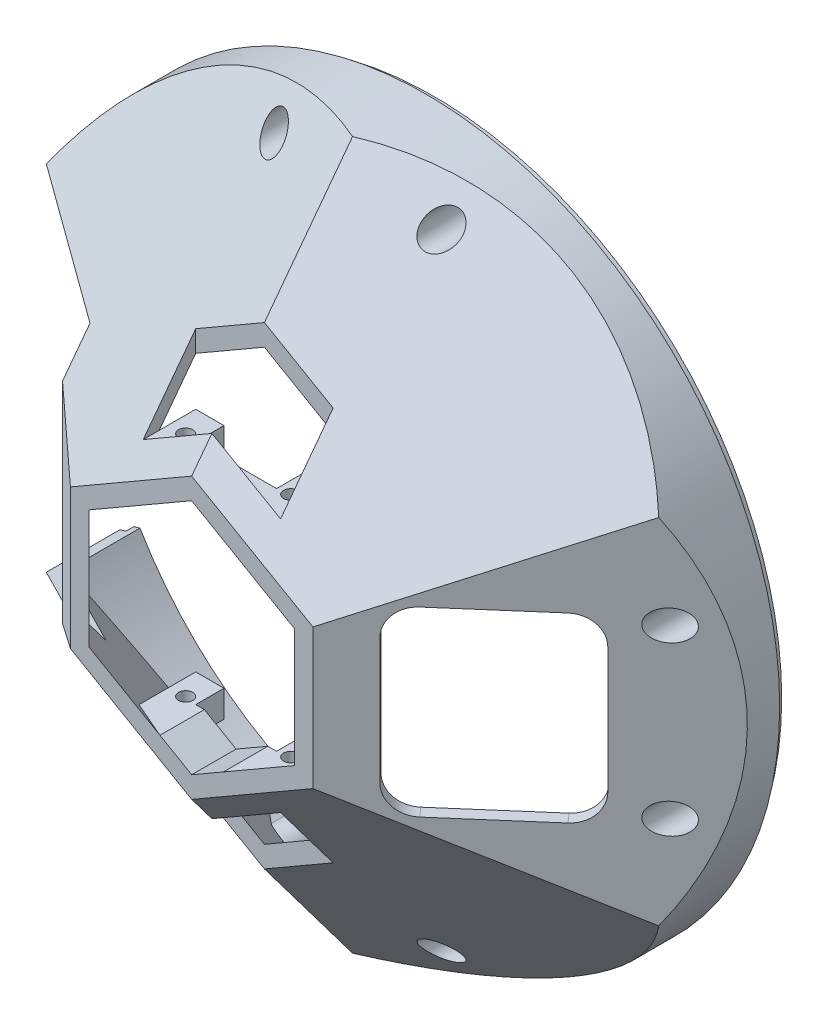
from build123d import *

# Parameters (mm, degrees)
SKETCH1_R                    = 87.5
BOSS_EXTRUDE1_DEPTH          = 60
CUT_EXTRUDE1_DEPTH           = 138.522725395
CIRPATTERN1_COUNT            = 6
SHELL1_T                     = -3
SKETCH3_R                    = 87.5
SKETCH3_R_2                  = 86
CUT_EXTRUDE2_DEPTH           = 2
CUT_EXTRUDE3_DEPTH           = 138.522725395
BOSS_EXTRUDE2_REACH          = 139.523
SKETCH6_R                    = 1.75
CUT_EXTRUDE4_DEPTH           = 138.522725395
SKETCH7_R                    = 3.75
CUT_EXTRUDE5_DEPTH           = 55
CIRPATTERN2_COPY_1_REACH     = 139.523
CIRPATTERN2_COPY_2_REACH     = 139.523
CIRPATTERN2_COPY_3_SKETCH_R  = 1.75
CIRPATTERN2_COPY_3_DEPTH     = 138.522725395
CIRPATTERN2_COPY_4_SKETCH_R  = 1.75
CIRPATTERN2_COPY_4_DEPTH     = 138.522725395
CIRPATTERN2_COPY_5_SKETCH_R  = 3.75
CIRPATTERN2_COPY_5_DEPTH     = 55
CIRPATTERN2_COPY_6_SKETCH_R  = 3.75
CIRPATTERN2_COPY_6_DEPTH     = 55
CIRPATTERN2_COPY_7_REACH     = 139.523
CIRPATTERN2_COPY_8_REACH     = 139.523
CIRPATTERN2_COPY_9_SKETCH_R  = 1.75
CIRPATTERN2_COPY_9_DEPTH     = 138.522725395
CIRPATTERN2_COPY_10_SKETCH_R = 1.75
CIRPATTERN2_COPY_10_DEPTH    = 138.522725395
CIRPATTERN2_COPY_11_SKETCH_R = 3.75
CIRPATTERN2_COPY_11_DEPTH    = 55
CIRPATTERN2_COPY_12_SKETCH_R = 3.75
CIRPATTERN2_COPY_12_DEPTH    = 55
CUT_EXTRUDE6_DEPTH           = 156.173102014
SKETCH10_W                   = 34
SKETCH10_H                   = 13
CUT_EXTRUDE8_DEPTH           = 138.522725395
BOSS_EXTRUDE4_REACH          = 132.677
SKETCH13_R                   = 1.75
SKETCH13_W                   = 20
SKETCH13_H                   = 7
CUT_EXTRUDE9_DEPTH           = 8


with BuildPart() as part:
    # Sketch1 → Boss-Extrude1 (new body)
    with BuildSketch(Plane.XY):
        Circle(SKETCH1_R)
    extrude(amount=BOSS_EXTRUDE1_DEPTH)

    # Sketch2 → Cut-Extrude1 (cut, symmetric)
    with BuildSketch(Plane(origin=(0, 0, 0), x_dir=(1, 0, 0), z_dir=(0, 1, 0))):
        Polygon((-73.465543034, -109.985374489), (-130.965543034, -59.985374489), (-87.5, -10), (-30, -60), align=None)
    cut_extrude1 = extrude(amount=CUT_EXTRUDE1_DEPTH, both=True, mode=Mode.SUBTRACT)

    # CirPattern1: Cut-Extrude1 ×6 about axis
    cirpattern1_axis = Axis((0, 0, 0), (0, 0, 1))
    for i in range(1, CIRPATTERN1_COUNT):
        add(cut_extrude1.rotate(cirpattern1_axis, i * 360 / CIRPATTERN1_COUNT), mode=Mode.SUBTRACT)

    # Shell1
    shell1_openings = [part.faces().sort_by_distance(p)[0] for p in [
        (0, 0, 0),
        (0, 0, 60),
    ]]
    offset(amount=SHELL1_T, openings=shell1_openings)

    # Sketch3 → Cut-Extrude2 (cut)
    with BuildSketch(Plane(origin=(0, 0, 0), x_dir=(-1, 0, 0), z_dir=(0, 0, -1))):
        Circle(SKETCH3_R)
        Circle(SKETCH3_R_2, mode=Mode.SUBTRACT)
    extrude(amount=-CUT_EXTRUDE2_DEPTH, mode=Mode.SUBTRACT)

    # Sketch4 → Cut-Extrude3 (cut, through all)
    with BuildSketch(Plane.XY):
        with BuildLine():
            Line((-45, 35), (-45, -35))
            Line((-45, -35), (-75.777222831, -43.75))
            ThreePointArc((-75.777222831, -43.75), (-87.5, 0), (-75.777222831, 43.75))
            Line((-75.777222831, 43.75), (-45, 35))
        make_face()
    extrude(amount=CUT_EXTRUDE3_DEPTH, mode=Mode.SUBTRACT)

    # Sketch5 → Boss-Extrude2 (add, up to next)
    with BuildSketch(Plane.XY, mode=Mode.PRIVATE) as boss_extrude2_sk1:
        with BuildLine():
            Line((-23.508288122, 73.13347302), (-31.375780211, 78.458972821))
            ThreePointArc((-31.375780211, 78.458972821), (-21.870209311, 81.620732321), (-12.057263685, 83.635353723))
            Line((-12.057263685, 83.635353723), (-16.207961797, 75.089589564))
            ThreePointArc((-16.207961797, 75.089589564), (-19.411428383, 72.444436972), (-23.508288122, 73.13347302))
        make_face()
    boss_extrude2_tool1 = extrude(boss_extrude2_sk1.sketch, amount=BOSS_EXTRUDE2_REACH, mode=Mode.PRIVATE) - part.part
    boss_extrude2 = boss_extrude2_tool1.solids().sort_by_distance((-20.887689, 77.953916, 0))[0]
    add(boss_extrude2)

    # Sketch6 → Cut-Extrude4 (cut, through all)
    with BuildSketch(Plane(origin=(0, 0, 0), x_dir=(-1, 0, 0), z_dir=(0, 0, -1))):
        with Locations((20.705523608, 77.274066103)):
            Circle(SKETCH6_R)
    cut_extrude4 = extrude(amount=-CUT_EXTRUDE4_DEPTH, mode=Mode.SUBTRACT)

    # Sketch7 → Cut-Extrude5 (cut)
    with BuildSketch(Plane.XY.offset(60)):
        with Locations((-20.705523608, 77.274066103)):
            Circle(SKETCH7_R)
    cut_extrude5 = extrude(amount=-CUT_EXTRUDE5_DEPTH, mode=Mode.SUBTRACT)

    # Mirror1: Boss-Extrude2, Cut-Extrude4, Cut-Extrude5 across plane
    add(boss_extrude2.mirror(Plane(origin=(0, 0, 0), x_dir=(0, 0, 1), z_dir=(1, 0, 0))))
    add(cut_extrude4.mirror(Plane(origin=(0, 0, 0), x_dir=(0, 0, 1), z_dir=(1, 0, 0))), mode=Mode.SUBTRACT)
    add(cut_extrude5.mirror(Plane(origin=(0, 0, 0), x_dir=(0, 0, 1), z_dir=(1, 0, 0))), mode=Mode.SUBTRACT)

    # CirPattern2 copy 1 sketch → CirPattern2 copy 1 (add, up to next)
    with BuildSketch(Plane(origin=(0, 0, 0), x_dir=(0, 1, 0), z_dir=(0, 0, 1)), mode=Mode.PRIVATE) as cirpattern2_copy_1_sk1:
        with BuildLine():
            Line((-23.508288122, -73.13347302), (-31.375780211, -78.458972821))
            ThreePointArc((-31.375780211, -78.458972821), (-21.870209311, -81.620732321), (-12.057263685, -83.635353723))
            Line((-12.057263685, -83.635353723), (-16.207961797, -75.089589564))
            ThreePointArc((-16.207961797, -75.089589564), (-19.411428383, -72.444436972), (-23.508288122, -73.13347302))
        make_face()
    cirpattern2_copy_1_tool1 = extrude(cirpattern2_copy_1_sk1.sketch, amount=CIRPATTERN2_COPY_1_REACH, mode=Mode.PRIVATE) - part.part
    add(cirpattern2_copy_1_tool1.solids().sort_by_distance((77.953916, -20.887689, 0))[0])

    # CirPattern2 copy 2 sketch → CirPattern2 copy 2 (add, up to next)
    with BuildSketch(Plane.XY, mode=Mode.PRIVATE) as cirpattern2_copy_2_sk1:
        with BuildLine():
            Line((-23.508288122, -73.13347302), (-31.375780211, -78.458972821))
            ThreePointArc((-31.375780211, -78.458972821), (-21.870209311, -81.620732321), (-12.057263685, -83.635353723))
            Line((-12.057263685, -83.635353723), (-16.207961797, -75.089589564))
            ThreePointArc((-16.207961797, -75.089589564), (-19.411428383, -72.444436972), (-23.508288122, -73.13347302))
        make_face()
    cirpattern2_copy_2_tool1 = extrude(cirpattern2_copy_2_sk1.sketch, amount=CIRPATTERN2_COPY_2_REACH, mode=Mode.PRIVATE) - part.part
    add(cirpattern2_copy_2_tool1.solids().sort_by_distance((-20.887689, -77.953916, 0))[0])

    # CirPattern2 copy 3 sketch → CirPattern2 copy 3 (cut, through all)
    with BuildSketch(Plane(origin=(0, 0, 0), x_dir=(0, -1, 0), z_dir=(0, 0, -1))):
        with Locations((20.705523608, -77.274066103)):
            Circle(CIRPATTERN2_COPY_3_SKETCH_R)
    extrude(amount=-CIRPATTERN2_COPY_3_DEPTH, mode=Mode.SUBTRACT)

    # CirPattern2 copy 4 sketch → CirPattern2 copy 4 (cut, through all)
    with BuildSketch(Plane(origin=(0, 0, 0), x_dir=(-1, 0, 0), z_dir=(0, 0, -1))):
        with Locations((20.705523608, -77.274066103)):
            Circle(CIRPATTERN2_COPY_4_SKETCH_R)
    extrude(amount=-CIRPATTERN2_COPY_4_DEPTH, mode=Mode.SUBTRACT)

    # CirPattern2 copy 5 sketch → CirPattern2 copy 5 (cut)
    with BuildSketch(Plane(origin=(0, 0, 60), x_dir=(0, 1, 0), z_dir=(0, 0, 1))):
        with Locations((-20.705523608, -77.274066103)):
            Circle(CIRPATTERN2_COPY_5_SKETCH_R)
    extrude(amount=-CIRPATTERN2_COPY_5_DEPTH, mode=Mode.SUBTRACT)

    # CirPattern2 copy 6 sketch → CirPattern2 copy 6 (cut)
    with BuildSketch(Plane.XY.offset(60)):
        with Locations((-20.705523608, -77.274066103)):
            Circle(CIRPATTERN2_COPY_6_SKETCH_R)
    extrude(amount=-CIRPATTERN2_COPY_6_DEPTH, mode=Mode.SUBTRACT)

    # CirPattern2 copy 7 sketch → CirPattern2 copy 7 (add, up to next)
    with BuildSketch(Plane(origin=(0, 0, 0), x_dir=(0, -1, 0), z_dir=(0, 0, 1)), mode=Mode.PRIVATE) as cirpattern2_copy_7_sk1:
        with BuildLine():
            Line((-23.508288122, 73.13347302), (-31.375780211, 78.458972821))
            ThreePointArc((-31.375780211, 78.458972821), (-21.870209311, 81.620732321), (-12.057263685, 83.635353723))
            Line((-12.057263685, 83.635353723), (-16.207961797, 75.089589564))
            ThreePointArc((-16.207961797, 75.089589564), (-19.411428383, 72.444436972), (-23.508288122, 73.13347302))
        make_face()
    cirpattern2_copy_7_tool1 = extrude(cirpattern2_copy_7_sk1.sketch, amount=CIRPATTERN2_COPY_7_REACH, mode=Mode.PRIVATE) - part.part
    add(cirpattern2_copy_7_tool1.solids().sort_by_distance((77.953916, 20.887689, 0))[0])

    # CirPattern2 copy 8 sketch → CirPattern2 copy 8 (add, up to next)
    with BuildSketch(Plane(origin=(0, 0, 0), x_dir=(-1, 0, 0), z_dir=(0, 0, 1)), mode=Mode.PRIVATE) as cirpattern2_copy_8_sk1:
        with BuildLine():
            Line((-23.508288122, 73.13347302), (-31.375780211, 78.458972821))
            ThreePointArc((-31.375780211, 78.458972821), (-21.870209311, 81.620732321), (-12.057263685, 83.635353723))
            Line((-12.057263685, 83.635353723), (-16.207961797, 75.089589564))
            ThreePointArc((-16.207961797, 75.089589564), (-19.411428383, 72.444436972), (-23.508288122, 73.13347302))
        make_face()
    cirpattern2_copy_8_tool1 = extrude(cirpattern2_copy_8_sk1.sketch, amount=CIRPATTERN2_COPY_8_REACH, mode=Mode.PRIVATE) - part.part
    add(cirpattern2_copy_8_tool1.solids().sort_by_distance((20.887689, -77.953916, 0))[0])

    # CirPattern2 copy 9 sketch → CirPattern2 copy 9 (cut, through all)
    with BuildSketch(Plane.YX):
        with Locations((20.705523608, 77.274066103)):
            Circle(CIRPATTERN2_COPY_9_SKETCH_R)
    extrude(amount=-CIRPATTERN2_COPY_9_DEPTH, mode=Mode.SUBTRACT)

    # CirPattern2 copy 10 sketch → CirPattern2 copy 10 (cut, through all)
    with BuildSketch(Plane(origin=(0, 0, 0), x_dir=(1, 0, 0), z_dir=(0, 0, -1))):
        with Locations((20.705523608, 77.274066103)):
            Circle(CIRPATTERN2_COPY_10_SKETCH_R)
    extrude(amount=-CIRPATTERN2_COPY_10_DEPTH, mode=Mode.SUBTRACT)

    # CirPattern2 copy 11 sketch → CirPattern2 copy 11 (cut)
    with BuildSketch(Plane(origin=(0, 0, 60), x_dir=(0, -1, 0), z_dir=(0, 0, 1))):
        with Locations((-20.705523608, 77.274066103)):
            Circle(CIRPATTERN2_COPY_11_SKETCH_R)
    extrude(amount=-CIRPATTERN2_COPY_11_DEPTH, mode=Mode.SUBTRACT)

    # CirPattern2 copy 12 sketch → CirPattern2 copy 12 (cut)
    with BuildSketch(Plane(origin=(0, 0, 60), x_dir=(-1, 0, 0), z_dir=(0, 0, 1))):
        with Locations((-20.705523608, 77.274066103)):
            Circle(CIRPATTERN2_COPY_12_SKETCH_R)
    extrude(amount=-CIRPATTERN2_COPY_12_DEPTH, mode=Mode.SUBTRACT)

    # Sketch8 → Cut-Extrude6 (cut, through all)
    with BuildSketch(Plane(origin=(42.626480086, 0, 49.020452099), x_dir=(0.7546055221635047, 0, -0.6561787149247867), z_dir=(0.6561787149247867, 0, 0.7546055221635047))):
        with BuildLine():
            Line((2, 22.5), (28, 22.5))
            ThreePointArc((28, 22.5), (32.949747468, 20.449747468), (35, 15.5))
            Line((35, 15.5), (35, -15.5))
            ThreePointArc((35, -15.5), (32.949747468, -20.449747468), (28, -22.5))
            Line((28, -22.5), (2, -22.5))
            ThreePointArc((2, -22.5), (-2.949747468, -20.449747468), (-5, -15.5))
            Line((-5, -15.5), (-5, 15.5))
            ThreePointArc((-5, 15.5), (-2.949747468, 20.449747468), (2, 22.5))
        make_face()
    extrude(amount=-CUT_EXTRUDE6_DEPTH, mode=Mode.SUBTRACT)

    # Sketch10 → Cut-Extrude8 (cut, through all)
    with BuildSketch(Plane(origin=(0, 0, 0), x_dir=(1, 0, 0), z_dir=(0, 1, 0))):
        with Locations((0, -48.5)):
            Rectangle(SKETCH10_W, SKETCH10_H)
    cut_extrude8 = extrude(amount=-CUT_EXTRUDE8_DEPTH, mode=Mode.SUBTRACT)

    # Sketch12 → Boss-Extrude4 (add, up to next)
    with BuildSketch(Plane.XY.offset(42), mode=Mode.PRIVATE) as boss_extrude4_sk1:
        Polygon((-17, -31.465589671), (17, -31.465589671), (17, -24.826061575), (7.856149608, -24.826061575), (0, -29.361811666), (-7.856149608, -24.826061575), (-17, -24.826061575), align=None)
    boss_extrude4_tool1 = extrude(boss_extrude4_sk1.sketch, amount=BOSS_EXTRUDE4_REACH, mode=Mode.PRIVATE) - part.part
    boss_extrude4 = boss_extrude4_tool1.solids().sort_by_distance((0, -31.119167, 42))[0]
    add(boss_extrude4)

    # Sketch13 → Cut-Extrude9 (cut)
    with BuildSketch(Plane.XZ.offset(31.465589671)):
        with Locations((-13, 48.5)):
            Circle(SKETCH13_R)
        with Locations((13, 48.5)):
            Circle(SKETCH13_R)
        with Locations((0, 45.5)):
            Rectangle(SKETCH13_W, SKETCH13_H)
    cut_extrude9 = extrude(amount=-CUT_EXTRUDE9_DEPTH, mode=Mode.SUBTRACT)

    # Mirror2: Cut-Extrude8, Boss-Extrude4, Cut-Extrude9 across plane
    add(cut_extrude8.mirror(Plane.ZX), mode=Mode.SUBTRACT)
    add(boss_extrude4.mirror(Plane.ZX))
    add(cut_extrude9.mirror(Plane.ZX), mode=Mode.SUBTRACT)


solid = part.part
